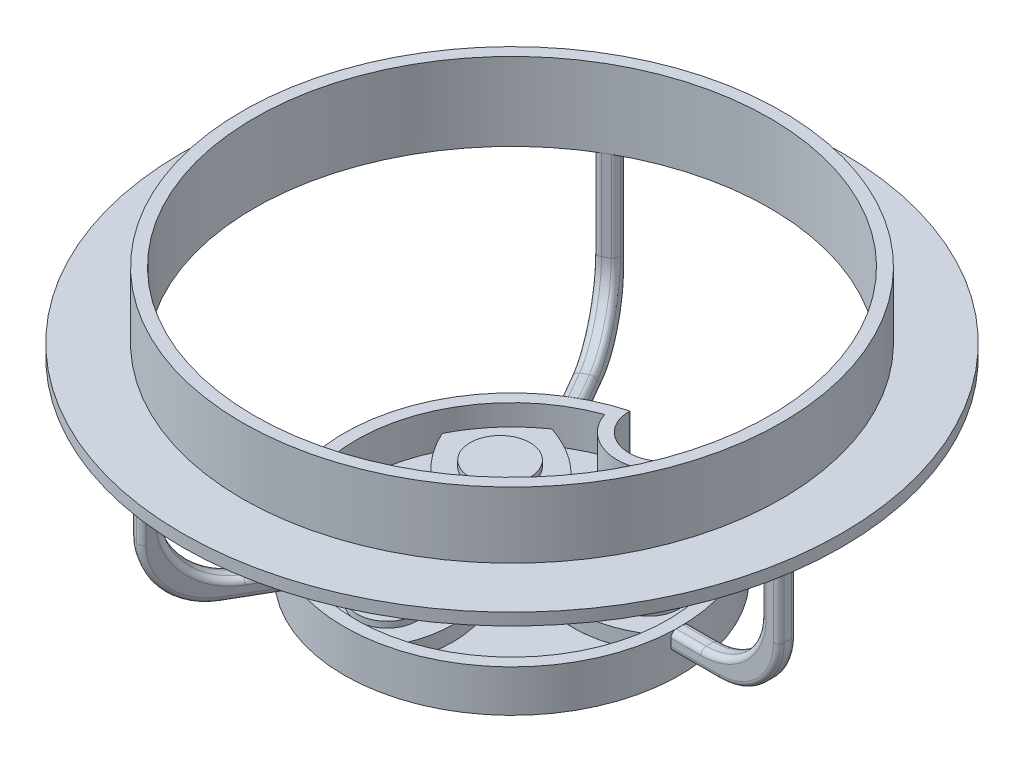
from build123d import *

# Parameters (mm, degrees)
BOSS_EXTRUDE2_DEPTH       = 6
CUT_EXTRUDE3_DEPTH        = 5
SKETCH12_R                = 8
SKETCH12_R_2              = 6.5
BOSS_EXTRUDE6_DEPTH       = 5
SKETCH13_R                = 3.5
SKETCH13_R_2              = 2
BOSS_EXTRUDE7_DEPTH       = 5
CUT_EXTRUDE4_START        = -5
SKETCH14_R                = 2
CUT_EXTRUDE4_DEPTH        = 5
BOSS_EXTRUDE8_DEPTH       = 6
SKETCH17_R                = 2.5
BOSS_EXTRUDE9_DEPTH       = 4.75
SKETCH18_R                = 2.5
CUT_EXTRUDE6_DEPTH        = 4.75
BOSS_EXTRUDE11_DEPTH      = 2.5
BOSS_EXTRUDE11_2_DEPTH    = 2.5
BOSS_EXTRUDE11_3_DEPTH    = 2.5
SKETCH20_R                = 5
BOSS_EXTRUDE12_DEPTH      = 1
CIRPATTERN4_COUNT         = 3
CUT_EXTRUDE7_START        = -1
CUT_EXTRUDE7_DEPTH        = 1
SKETCH23_R                = 45
SKETCH23_R_2              = 43
BOSS_EXTRUDE13_DEPTH      = 13
SKETCH24_R                = 55
SKETCH24_R_2              = 45
BOSS_EXTRUDE14_DEPTH      = 2
EXTRUDE_THIN1_DEPTH       = 1.5
FILLET1_R                 = 10
FILLET2_R                 = 0.9
CIRPATTERN12_COUNT        = 3
FILLET1_OF_CIRPATTERN12_R = 10
FILLET2_OF_CIRPATTERN12_R = 0.9


# Read off the part's stored shape, not the designer's step: Cut-Extrude7
with BuildPart() as part:
    # Sketch4 → Boss-Extrude2 (new body)
    with BuildSketch(Plane(origin=(0, 0, 0), x_dir=(1, 0, 0), z_dir=(0, 1, 0))):
        with BuildLine():
            Line((-7.333333333, 26.881246441), (-7.333333333, 27.022624266))
            ThreePointArc((-7.333333333, 27.022624266), (1.365120132, -27.96670247), (4.666666667, 27.608372321))
            Line((4.666666667, 27.608372321), (4.666666667, 26.881246441))
            ThreePointArc((4.666666667, 26.881246441), (-1.333333333, 20.881246441), (-7.333333333, 26.881246441))
        make_face()
    extrude(amount=BOSS_EXTRUDE2_DEPTH)

    # Sketch10 → Cut-Extrude3 (cut)
    with BuildSketch(Plane(origin=(0, 6, 0), x_dir=(1, 0, 0), z_dir=(0, 1, 0))):
        with BuildLine():
            ThreePointArc((-7.842635767, 40.242925642), (0, -41), (7.842635767, 40.242925642))
            ThreePointArc((7.842635767, 40.242925642), (0, 33.821869662), (-7.842635767, 40.242925642))
        make_face()
    extrude(amount=-CUT_EXTRUDE3_DEPTH, mode=Mode.SUBTRACT)

    # Sketch12 → Boss-Extrude6 (add)
    with BuildSketch(Plane(origin=(0, 1, 0), x_dir=(1, 0, 0), z_dir=(0, 1, 0))):
        with Locations(Location((0, 0, 0), (0, 0, 270))):
            Circle(SKETCH12_R)
        with Locations(Location((0, 0, 0), (0, 0, 270))):
            Circle(SKETCH12_R_2, mode=Mode.SUBTRACT)
    extrude(amount=BOSS_EXTRUDE6_DEPTH)

    # Sketch13 → Boss-Extrude7 (add)
    with BuildSketch(Plane(origin=(0, 1, 0), x_dir=(1, 0, 0), z_dir=(0, 1, 0))):
        with Locations(Location((0, 0, 0), (0, 0, 270))):
            Circle(SKETCH13_R)
        with Locations(Location((0, 0, 0), (0, 0, 270))):
            Circle(SKETCH13_R_2, mode=Mode.SUBTRACT)
    extrude(amount=BOSS_EXTRUDE7_DEPTH)

    # Sketch14 → Cut-Extrude4 (cut)
    with BuildSketch(Plane(origin=(0, 1, 0), x_dir=(1, 0, 0), z_dir=(0, 1, 0)).offset(CUT_EXTRUDE4_START)):
        with Locations(Location((0, 0, 0), (0, 0, 270))):
            Circle(SKETCH14_R)
    extrude(amount=CUT_EXTRUDE4_DEPTH, mode=Mode.SUBTRACT)

    # Sketch16 → Boss-Extrude8 (add)
    with BuildSketch(Plane(origin=(0, 1, 0), x_dir=(1, 0, 0), z_dir=(0, 1, 0))):
        with BuildLine():
            Line((4.666666667, 27.608372321), (4.666666667, 26.881246441))
            ThreePointArc((4.666666667, 26.881246441), (-1.333333333, 20.881246441), (-7.333333333, 26.881246441))
            Line((-7.333333333, 26.881246441), (-7.333333333, 27.022624266))
            ThreePointArc((-7.333333333, 27.022624266), (1.365120132, -27.96670247), (4.666666667, 27.608372321))
        make_face()
        with BuildLine():
            ThreePointArc((-8.943210346, 24.413500132), (1.288039265, -25.968075686), (6.483395174, 25.178673258))
            ThreePointArc((6.483395174, 25.178673258), (-0.937013559, 18.891069307), (-8.943210346, 24.413500132))
        make_face(mode=Mode.SUBTRACT)
    extrude(amount=BOSS_EXTRUDE8_DEPTH)

    # Sketch17 → Boss-Extrude9 (add)
    with BuildSketch(Plane(origin=(0, 1, 0), x_dir=(1, 0, 0), z_dir=(0, 1, 0))):
        with Locations((-7.528329896, 5.794329035)):
            Circle(SKETCH17_R)
    boss_extrude9 = extrude(amount=BOSS_EXTRUDE9_DEPTH)

    # Sketch18 → Cut-Extrude6 (cut)
    with BuildSketch(Plane(origin=(0, 5.75, 0), x_dir=(1, 0, 0), z_dir=(0, 1, 0))):
        with Locations((-7.528329896, 5.794329035)):
            Circle(SKETCH18_R)
    extrude(amount=CUT_EXTRUDE6_DEPTH, mode=Mode.SUBTRACT)

    # CirPattern4: Boss-Extrude9 ×3 about axis
    cirpattern4_axis = Axis((0, 0, 0), (0, 1, 0))
    for i in range(1, CIRPATTERN4_COUNT):
        add(boss_extrude9.rotate(cirpattern4_axis, i * 360 / CIRPATTERN4_COUNT))

    # Cut-Extrude7 outline → Cut-Extrude7 (cut)
    with BuildSketch(Plane.XZ.offset(CUT_EXTRUDE7_START)):
        with BuildLine():
            add(Edge.make_bspline(
                [(25.917603597, -2.068290448), (17.735325022, 5.064664854), (7.675830426, 2.254246499)],
                knots=[0.499136884, 0.499136884, 0.499136884, 0.500727404, 0.500727404, 0.500727404], degree=2))
            add(Edge.make_bspline(
                [(7.675830426, 2.254246499), (8.182629686, 0.51544525), (7.896149227, -1.284845277)],
                knots=[0.499792092, 0.499792092, 0.499792092, 0.50023809, 0.50023809, 0.50023809], degree=2))
            ThreePointArc((7.896149227, -1.284845277), (11.093306641, -4.575865795), (6.505687465, -4.655752422))
            add(Edge.make_bspline(
                [(6.505687465, -4.655752422), (5.683414626, -5.802240868), (4.516184302, -6.6033385)],
                knots=[0.499835311, 0.499835311, 0.499835311, 0.50018465, 0.50018465, 0.50018465], degree=2))
            add(Edge.make_bspline(
                [(4.516184302, -6.6033385), (10.724946631, -15.259558506), (21.680283533, -14.351491446)],
                knots=[0.49923587, 0.49923587, 0.49923587, 0.50086968, 0.50086968, 0.50086968], degree=2))
            add(Edge.make_bspline(
                [(21.680283533, -14.351491446), (25.353389353, -8.761695061), (25.917603597, -2.068290448)],
                knots=[0.499561882, 0.499561882, 0.499561882, 0.500470034, 0.500470034, 0.500470034], degree=2))
        make_face()
        with BuildLine():
            add(Edge.make_bspline(
                [(-11.167609728, 23.479448344), (-13.253790936, 12.826909586), (-5.790149947, 5.520340895)],
                knots=[0.499136884, 0.499136884, 0.499136884, 0.500727404, 0.500727404, 0.500727404], degree=2))
            add(Edge.make_bspline(
                [(-5.790149947, 5.520340895), (-4.537703523, 6.828642553), (-2.835365964, 7.480688461)],
                knots=[0.499792092, 0.499792092, 0.499792092, 0.50023809, 0.50023809, 0.50023809], degree=2))
            ThreePointArc((-2.835365964, 7.480688461), (-1.583837298, 11.89501826), (0.779156138, 7.961966824))
            add(Edge.make_bspline(
                [(0.779156138, 7.961966824), (2.183180678, 7.82310188), (3.460566739, 7.212799583)],
                knots=[0.499835311, 0.499835311, 0.499835311, 0.50018465, 0.50018465, 0.50018465], degree=2))
            add(Edge.make_bspline(
                [(3.460566739, 7.212799583), (7.852692001, 16.917855489), (1.588614408, 25.951422024)],
                knots=[0.49923587, 0.49923587, 0.49923587, 0.50086968, 0.50086968, 0.50086968], degree=2))
            add(Edge.make_bspline(
                [(1.588614408, 25.951422024), (-5.088844173, 26.337526782), (-11.167609728, 23.479448344)],
                knots=[0.499561882, 0.499561882, 0.499561882, 0.500470034, 0.500470034, 0.500470034], degree=2))
        make_face()
        with BuildLine():
            ThreePointArc((-5.060783263, -6.195843184), (-9.509469343, -7.319152466), (-7.284843603, -3.306214403))
            add(Edge.make_bspline(
                [(-7.284843603, -3.306214403), (-7.866595303, -2.020861012), (-7.976751041, -0.609461084)],
                knots=[0.499835311, 0.499835311, 0.499835311, 0.50018465, 0.50018465, 0.50018465], degree=2))
            add(Edge.make_bspline(
                [(-7.976751041, -0.609461084), (-18.577638631, -1.658296984), (-23.268897941, -11.599930579)],
                knots=[0.49923587, 0.49923587, 0.49923587, 0.50086968, 0.50086968, 0.50086968], degree=2))
            add(Edge.make_bspline(
                [(-23.268897941, -11.599930579), (-20.26454518, -17.575831721), (-14.749993878, -21.411157909)],
                knots=[0.499561882, 0.499561882, 0.499561882, 0.500470034, 0.500470034, 0.500470034], degree=2))
            add(Edge.make_bspline(
                [(-14.749993878, -21.411157909), (-4.481534085, -17.891574441), (-1.885680478, -7.774587393)],
                knots=[0.499136884, 0.499136884, 0.499136884, 0.500727404, 0.500727404, 0.500727404], degree=2))
            add(Edge.make_bspline(
                [(-1.885680478, -7.774587393), (-3.644926162, -7.344087802), (-5.060783263, -6.195843184)],
                knots=[0.499792092, 0.499792092, 0.499792092, 0.50023809, 0.50023809, 0.50023809], degree=2))
        make_face()
    extrude(amount=CUT_EXTRUDE7_DEPTH, mode=Mode.SUBTRACT)


with BuildPart() as body_2:
    # Sketch19 → Boss-Extrude11 (new body)
    with BuildSketch(Plane(origin=(0, 1, 0), x_dir=(1, 0, 0), z_dir=(0, 1, 0))):
        with BuildLine():
            ThreePointArc((7.896149227, 1.284845277), (11.093306641, 4.575865795), (6.505687465, 4.655752422))
            add(Edge.make_bspline(
                [(4.516184303, 6.6033385), (5.683414626, 5.802240869), (6.505687465, 4.655752422)],
                knots=[0, 0, 0, 1, 1, 1], degree=2))
            add(Edge.make_bspline(
                [(4.516184303, 6.6033385), (10.724946626, 15.259558498), (21.680283514, 14.351491447)],
                knots=[0, 0, 0, 1, 1, 1], degree=2))
            add(Edge.make_bspline(
                [(25.917603568, 2.068290423), (25.353389334, 8.761695066), (21.680283514, 14.351491447)],
                knots=[0, 0, 0, 1, 1, 1], degree=2))
            add(Edge.make_bspline(
                [(7.675830431, -2.25424648), (17.735325007, -5.06466484), (25.917603568, 2.068290423)],
                knots=[0, 0, 0, 1, 1, 1], degree=2))
            add(Edge.make_bspline(
                [(7.675830431, -2.25424648), (8.182629683, -0.515445231), (7.896149227, 1.284845277)],
                knots=[0, 0, 0, 1, 1, 1], degree=2))
        make_face()
    extrude(amount=BOSS_EXTRUDE11_DEPTH)


with BuildPart() as body_3:
    # Sketch19 → Boss-Extrude11 2 (new body)
    with BuildSketch(Plane(origin=(0, 1, 0), x_dir=(1, 0, 0), z_dir=(0, 1, 0))):
        with BuildLine():
            ThreePointArc((-2.835365964, -7.480688461), (-1.583837298, -11.89501826), (0.779156138, -7.961966824))
            add(Edge.make_bspline(
                [(3.460566739, -7.212799584), (2.183180678, -7.823101881), (0.779156138, -7.961966824)],
                knots=[0, 0, 0, 1, 1, 1], degree=2))
            add(Edge.make_bspline(
                [(3.460566739, -7.212799584), (7.852691996, -16.917855481), (1.588614418, -25.951422008)],
                knots=[0, 0, 0, 1, 1, 1], degree=2))
            add(Edge.make_bspline(
                [(-11.167609735, -23.479448307), (-5.08884416, -26.337526769), (1.588614418, -25.951422008)],
                knots=[0, 0, 0, 1, 1, 1], degree=2))
            add(Edge.make_bspline(
                [(-5.790149934, -5.520340908), (-13.253790916, -12.826909581), (-11.167609735, -23.479448307)],
                knots=[0, 0, 0, 1, 1, 1], degree=2))
            add(Edge.make_bspline(
                [(-5.790149934, -5.520340908), (-4.537703505, -6.82864256), (-2.835365964, -7.480688461)],
                knots=[0, 0, 0, 1, 1, 1], degree=2))
        make_face()
    extrude(amount=BOSS_EXTRUDE11_2_DEPTH)


with BuildPart() as body_4:
    # Sketch19 → Boss-Extrude11 3 (new body)
    with BuildSketch(Plane(origin=(0, 1, 0), x_dir=(1, 0, 0), z_dir=(0, 1, 0))):
        with BuildLine():
            ThreePointArc((-5.060783263, 6.195843184), (-9.509469343, 7.319152466), (-7.284843603, 3.306214403))
            add(Edge.make_bspline(
                [(-7.976751042, 0.609461084), (-7.866595304, 2.020861012), (-7.284843603, 3.306214403)],
                knots=[0, 0, 0, 1, 1, 1], degree=2))
            add(Edge.make_bspline(
                [(-7.976751042, 0.609461084), (-18.577638622, 1.658296984), (-23.268897932, 11.599930561)],
                knots=[0, 0, 0, 1, 1, 1], degree=2))
            add(Edge.make_bspline(
                [(-14.749993833, 21.411157884), (-20.264545175, 17.575831703), (-23.268897932, 11.599930561)],
                knots=[0, 0, 0, 1, 1, 1], degree=2))
            add(Edge.make_bspline(
                [(-1.885680497, 7.774587389), (-4.481534091, 17.89157442), (-14.749993833, 21.411157884)],
                knots=[0, 0, 0, 1, 1, 1], degree=2))
            add(Edge.make_bspline(
                [(-1.885680497, 7.774587389), (-3.644926177, 7.34408779), (-5.060783263, 6.195843184)],
                knots=[0, 0, 0, 1, 1, 1], degree=2))
        make_face()
    extrude(amount=BOSS_EXTRUDE11_3_DEPTH)

    # Sketch20 → Boss-Extrude12 (add)
    with BuildSketch(Plane(origin=(0, 3.5, 0), x_dir=(1, 0, 0), z_dir=(0, 1, 0))):
        with Locations(Location((-13.601547288, 11.609344872, 0), (0, 0, 270))):
            Circle(SKETCH20_R)
        with Locations(Location((16.854761224, 5.974613046, 0), (0, 0, 270))):
            Circle(SKETCH20_R)
        with Locations(Location((-3.253213937, -17.583957918, 0), (0, 0, 270))):
            Circle(SKETCH20_R)
    extrude(amount=BOSS_EXTRUDE12_DEPTH)


with BuildPart() as boss_extrude12_piece_1:
    # of the separate pieces the step leaves, piece 1, a body of its own (boss_extrude12_pieces)
    add(body_4.part.solids().sort_by_distance((-5.060783263, 1, -6.195843184))[0])


with BuildPart() as boss_extrude12_piece_2:
    # of the separate pieces the step leaves, piece 2, a body of its own (boss_extrude12_pieces)
    add(body_4.part.solids().sort_by_distance((16.854761224, 3.5, -0.974613046))[0])


with BuildPart() as boss_extrude12_piece_3:
    # of the separate pieces the step leaves, piece 3, a body of its own (boss_extrude12_pieces)
    add(body_4.part.solids().sort_by_distance((-3.253213937, 3.5, 22.583957918))[0])


with BuildPart() as body_7:
    # Sketch23 → Boss-Extrude13 (new body)
    with BuildSketch(Plane(origin=(0, 32, 0), x_dir=(1, 0, 0), z_dir=(0, 1, 0))):
        with Locations(Location((0, 0, 0), (0, 0, 270))):
            Circle(SKETCH23_R)
        with Locations(Location((0, 0, 0), (0, 0, 270))):
            Circle(SKETCH23_R_2, mode=Mode.SUBTRACT)
    extrude(amount=BOSS_EXTRUDE13_DEPTH)

    # Sketch24 → Boss-Extrude14 (add)
    with BuildSketch(Plane(origin=(0, 32, 0), x_dir=(1, 0, 0), z_dir=(0, 1, 0))):
        with Locations(Location((0, 0, 0), (0, 0, 270))):
            Circle(SKETCH24_R)
        with Locations(Location((0, 0, 0), (0, 0, 270))):
            Circle(SKETCH24_R_2, mode=Mode.SUBTRACT)
    extrude(amount=BOSS_EXTRUDE14_DEPTH)

    # Sketch25 → Extrude-Thin1 (add, symmetric)
    with BuildSketch(Plane.XY):
        Polygon((43, 32), (43, 7), (28, 7), (28, 4), (46, 4), (46, 32), align=None)
    extrude_thin1 = extrude(amount=EXTRUDE_THIN1_DEPTH, both=True)

    # Fillet1
    fillet1_edges = [body_7.edges().sort_by_distance(p)[0] for p in [
        (43, 7, 0),
        (46, 4, 0),
    ]]
    fillet(fillet1_edges, radius=FILLET1_R)

    # Fillet2
    fillet2_edges = [body_7.edges().sort_by_distance(p)[0] for p in [
        (46, 23, 1.5),
        (43, 24.5, -1.5),
        (43, 24.5, 1.5),
        (46, 23, -1.5),
        (30.5, 7, -1.5),
        (30.5, 7, 1.5),
        (32, 4, -1.5),
        (43.071067812, 6.928932188, -1.5),
        (32, 4, 1.5),
        (43.071067812, 6.928932188, 1.5),
        (40.071067812, 9.928932188, -1.5),
        (40.071067812, 9.928932188, 1.5),
    ]]
    fillet(fillet2_edges, radius=FILLET2_R)

    # CirPattern12: Extrude-Thin1 ×3 about axis
    cirpattern12_axis = Axis((0, 0, 0), (0, 1, 0))
    for i in range(1, CIRPATTERN12_COUNT):
        add(extrude_thin1.rotate(cirpattern12_axis, i * 360 / CIRPATTERN12_COUNT))

    # Fillet1 of CirPattern12
    fillet1_of_cirpattern12_edges = [body_7.edges().sort_by_distance(p)[0] for p in [
        (-21.5, 7, -37.239092363),
        (-23, 4, -39.837168574),
        (-21.5, 7, 37.239092363),
        (-23, 4, 39.837168574),
    ]]
    fillet(fillet1_of_cirpattern12_edges, radius=FILLET1_OF_CIRPATTERN12_R)

    # Fillet2 of CirPattern12
    fillet2_of_cirpattern12_edges = [body_7.edges().sort_by_distance(p)[0] for p in [
        (-21.700961894, 23, -40.587168574),
        (-22.799038106, 24.5, -36.489092363),
        (-20.200961894, 24.5, -37.989092363),
        (-24.299038106, 23, -39.087168574),
        (-16.549038106, 7, -25.663774815),
        (-13.950961894, 7, -27.163774815),
        (-17.299038106, 4, -26.962812921),
        (-22.834572012, 6.928932188, -36.550638893),
        (-14.700961894, 4, -28.462812921),
        (-20.2364958, 6.928932188, -38.050638893),
        (-21.334572012, 9.928932188, -33.952562682),
        (-18.7364958, 9.928932188, -35.452562682),
        (-24.299038106, 23, 39.087168574),
        (-20.200961894, 24.5, 37.989092363),
        (-22.799038106, 24.5, 36.489092363),
        (-21.700961894, 23, 40.587168574),
        (-13.950961894, 7, 27.163774815),
        (-16.549038106, 7, 25.663774815),
        (-14.700961894, 4, 28.462812921),
        (-20.2364958, 6.928932188, 38.050638893),
        (-17.299038106, 4, 26.962812921),
        (-22.834572012, 6.928932188, 36.550638893),
        (-18.7364958, 9.928932188, 35.452562682),
        (-21.334572012, 9.928932188, 33.952562682),
    ]]
    fillet(fillet2_of_cirpattern12_edges, radius=FILLET2_OF_CIRPATTERN12_R)


solid = Compound([part.part, body_2.part, body_3.part, boss_extrude12_piece_1.part, boss_extrude12_piece_2.part, boss_extrude12_piece_3.part, body_7.part])
